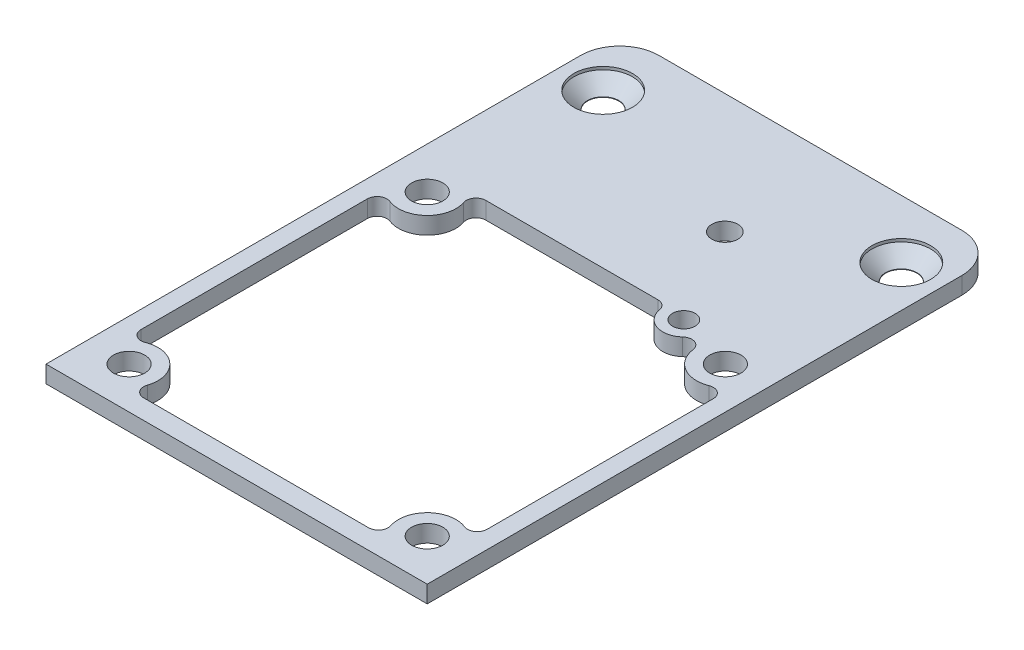
from build123d import *

# Parameters (mm, degrees)
SKETCH1_R               = 1.6
SKETCH1_R_2             = 1.15
SKETCH1_R_3             = 1.33
BASE_SHAPE_DEPTH        = 1.75
MILLING_FILLETS_R       = 1
SKETCH3_R               = 3
SCREW_HEAD_CUT_DEPTH    = 0.3
SCREW_HEAD_CHAMFER_SIZE = 1.4


with BuildPart() as part:
    # Sketch1 → Base shape (new body)
    with BuildSketch(Plane(origin=(0, 0, 0), x_dir=(1, 0, 0), z_dir=(0, 1, 0))):
        with BuildLine():
            Line((15.5, 39.2), (-15.5, 39.2))
            ThreePointArc((-15.5, 39.2), (-18.328427125, 38.028427125), (-19.5, 35.2))
            Line((-19.5, 35.2), (-19.5, -19.5))
            Line((-19.5, -19.5), (19.5, -19.5))
            Line((19.5, -19.5), (19.5, 35.2))
            ThreePointArc((19.5, 35.2), (18.328427125, 38.028427125), (15.5, 39.2))
        make_face()
        with Locations(Location((-15.25, -15.25, 0), (0, 0, 270))):
            Circle(SKETCH1_R, mode=Mode.SUBTRACT)
        with Locations(Location((15.25, -15.25, 0), (0, 0, 270))):
            Circle(SKETCH1_R, mode=Mode.SUBTRACT)
        with BuildLine():
            ThreePointArc((-17.7, 13.606832327), (-13.284874461, 13.049822367), (-13.341630288, 17.499583304))
            Line((-13.341630288, 17.499583304), (7.05, 17.499583304))
            Line((7.05, 17.499583304), (7.05, 17.05))
            ThreePointArc((7.05, 17.05), (8.336587223, 15.08098543), (10.656528722, 15.46853736))
            ThreePointArc((10.656528722, 15.46853736), (11.674639953, 15.673161101), (12.325380263, 14.863866097))
            ThreePointArc((12.325380263, 14.863866097), (14.578174541, 12.377518398), (17.7, 13.606832327))
            Line((17.7, 13.606832327), (17.7, -13.606832327))
            ThreePointArc((17.7, -13.606832327), (13.284874461, -13.049822367), (13.341630288, -17.499583304))
            Line((13.341630288, -17.499583304), (-13.341630288, -17.499583304))
            ThreePointArc((-13.341630288, -17.499583304), (-13.284874461, -13.049822367), (-17.7, -13.606832327))
            Line((-17.7, -13.606832327), (-17.7, 13.606832327))
        make_face(mode=Mode.SUBTRACT)
        with Locations(Location((-15.25, 15.25, 0), (0, 0, 270))):
            Circle(SKETCH1_R, mode=Mode.SUBTRACT)
        with Locations(Location((-15.25, 33.25, 0), (0, 0, 270))):
            Circle(SKETCH1_R, mode=Mode.SUBTRACT)
        with Locations(Location((9.2, 17.05, 0), (0, 0, 270))):
            Circle(SKETCH1_R_2, mode=Mode.SUBTRACT)
        with Locations(Location((15.25, 15.25, 0), (0, 0, 270))):
            Circle(SKETCH1_R, mode=Mode.SUBTRACT)
        with Locations(Location((3.5, 26.95, 0), (0, 0, 270))):
            Circle(SKETCH1_R_3, mode=Mode.SUBTRACT)
        with Locations(Location((15.25, 33.25, 0), (0, 0, 270))):
            Circle(SKETCH1_R, mode=Mode.SUBTRACT)
    extrude(amount=BASE_SHAPE_DEPTH)

    # Milling fillets
    milling_fillets_edges = [part.edges().sort_by_distance(p)[0] for p in [
        (-17.7, 0.875, 13.606832327),
        (-13.341630288, 0.875, 17.499583304),
        (13.341630288, 0.875, 17.499583304),
        (17.7, 0.875, 13.606832327),
        (17.7, 0.875, -13.606832327),
        (-13.341630288, 0.875, -17.499583304),
        (-17.7, 0.875, -13.606832327),
        (7.05, 0.875, -17.499583304),
    ]]
    fillet(milling_fillets_edges, radius=MILLING_FILLETS_R)

    # Sketch3 → Screw head cut (cut)
    with BuildSketch(Plane(origin=(0, 1.75, 0), x_dir=(1, 0, 0), z_dir=(0, 1, 0))):
        with Locations(Location((-15.25, 33.25, 0), (0, 0, 270))):
            Circle(SKETCH3_R)
        with Locations(Location((15.25, 33.25, 0), (0, 0, 270))):
            Circle(SKETCH3_R)
    extrude(amount=-SCREW_HEAD_CUT_DEPTH, mode=Mode.SUBTRACT)

    # Screw head chamfer
    screw_head_chamfer_edges = [part.edges().sort_by_distance(p)[0] for p in [
        (-15.25, 1.45, -34.85),
        (15.25, 1.45, -34.85),
    ]]
    chamfer(screw_head_chamfer_edges, length=SCREW_HEAD_CHAMFER_SIZE - 0.0001)  # a hair under: the kernel refuses the full size


solid = part.part
